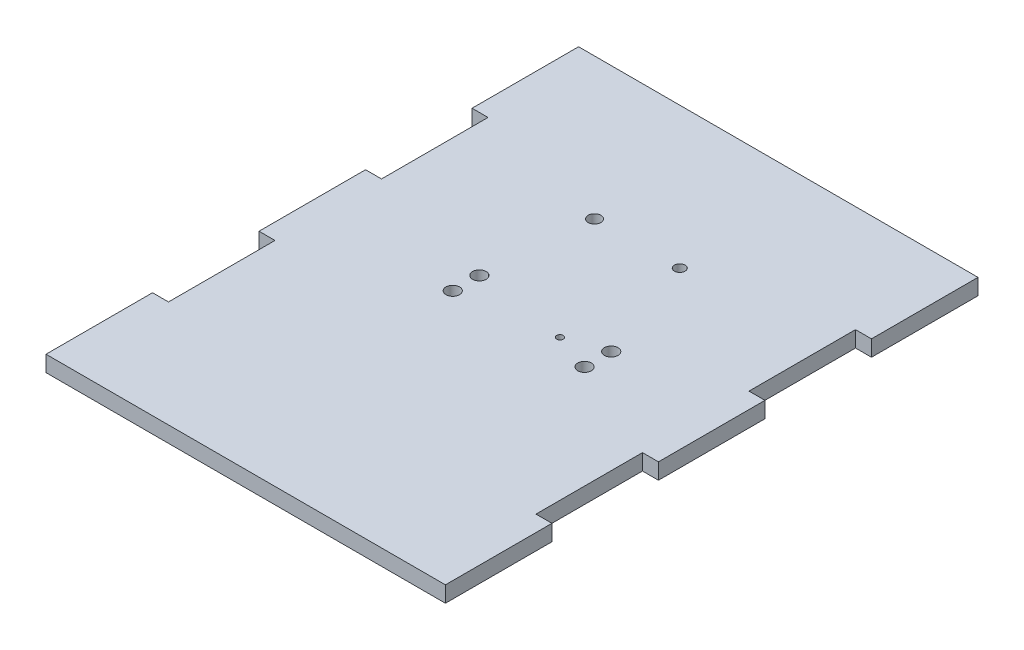
from build123d import *

# Parameters (mm, degrees)
SKETCH1_W           = 150
SKETCH1_H           = 200
BOSS_EXTRUDE1_DEPTH = 6
SKETCH2_W           = 6
SKETCH2_H           = 40
CUT_EXTRUDE1_DEPTH  = 6
SKETCH6_R           = 1.23
CUT_EXTRUDE6_DEPTH  = 126.143917151
SKETCH7_R           = 2
CUT_EXTRUDE7_DEPTH  = 126.143917151
SKETCH8_R           = 2.38
CUT_EXTRUDE8_DEPTH  = 126.143917151
SKETCH9_R           = 2.55
CUT_EXTRUDE9_DEPTH  = 126.143917151


with BuildPart() as part:
    # Sketch1 → Boss-Extrude1 (new body)
    with BuildSketch(Plane(origin=(0, 0, 0), x_dir=(1, 0, 0), z_dir=(0, 1, 0))):
        Rectangle(SKETCH1_W, SKETCH1_H)
    extrude(amount=BOSS_EXTRUDE1_DEPTH)

    # Sketch2 → Cut-Extrude1 (cut)
    with BuildSketch(Plane(origin=(0, 6, 0), x_dir=(1, 0, 0), z_dir=(0, 1, 0))):
        with Locations((-72, 40)):
            Rectangle(SKETCH2_W, SKETCH2_H)
        with Locations((72, 40)):
            Rectangle(SKETCH2_W, SKETCH2_H)
        with Locations((72, -40)):
            Rectangle(SKETCH2_W, SKETCH2_H)
        with Locations((-72, -40)):
            Rectangle(SKETCH2_W, SKETCH2_H)
    extrude(amount=-CUT_EXTRUDE1_DEPTH, mode=Mode.SUBTRACT)

    # Sketch6 → Cut-Extrude6 (cut, through all)
    with BuildSketch(Plane(origin=(0, 6, 0), x_dir=(1, 0, 0), z_dir=(0, 1, 0))):
        with Locations((16, 2)):
            Circle(SKETCH6_R)
    extrude(amount=-CUT_EXTRUDE6_DEPTH, mode=Mode.SUBTRACT)

    # Sketch7 → Cut-Extrude7 (cut, through all)
    with BuildSketch(Plane(origin=(0, 6, 0), x_dir=(1, 0, 0), z_dir=(0, 1, 0))):
        with Locations((16, 47)):
            Circle(SKETCH7_R)
    extrude(amount=-CUT_EXTRUDE7_DEPTH, mode=Mode.SUBTRACT)

    # Sketch8 → Cut-Extrude8 (cut, through all)
    with BuildSketch(Plane(origin=(0, 6, 0), x_dir=(1, 0, 0), z_dir=(0, 1, 0))):
        with Locations((-16, 47)):
            Circle(SKETCH8_R)
    extrude(amount=-CUT_EXTRUDE8_DEPTH, mode=Mode.SUBTRACT)

    # Sketch9 → Cut-Extrude9 (cut, through all)
    with BuildSketch(Plane(origin=(0, 6, 0), x_dir=(1, 0, 0), z_dir=(0, 1, 0))):
        with Locations((30.25, 7)):
            Circle(SKETCH9_R)
        with Locations((30.25, -3)):
            Circle(SKETCH9_R)
        with Locations((-19.25, 7)):
            Circle(SKETCH9_R)
        with Locations((-19.25, -3)):
            Circle(SKETCH9_R)
    extrude(amount=-CUT_EXTRUDE9_DEPTH, mode=Mode.SUBTRACT)


solid = part.part
